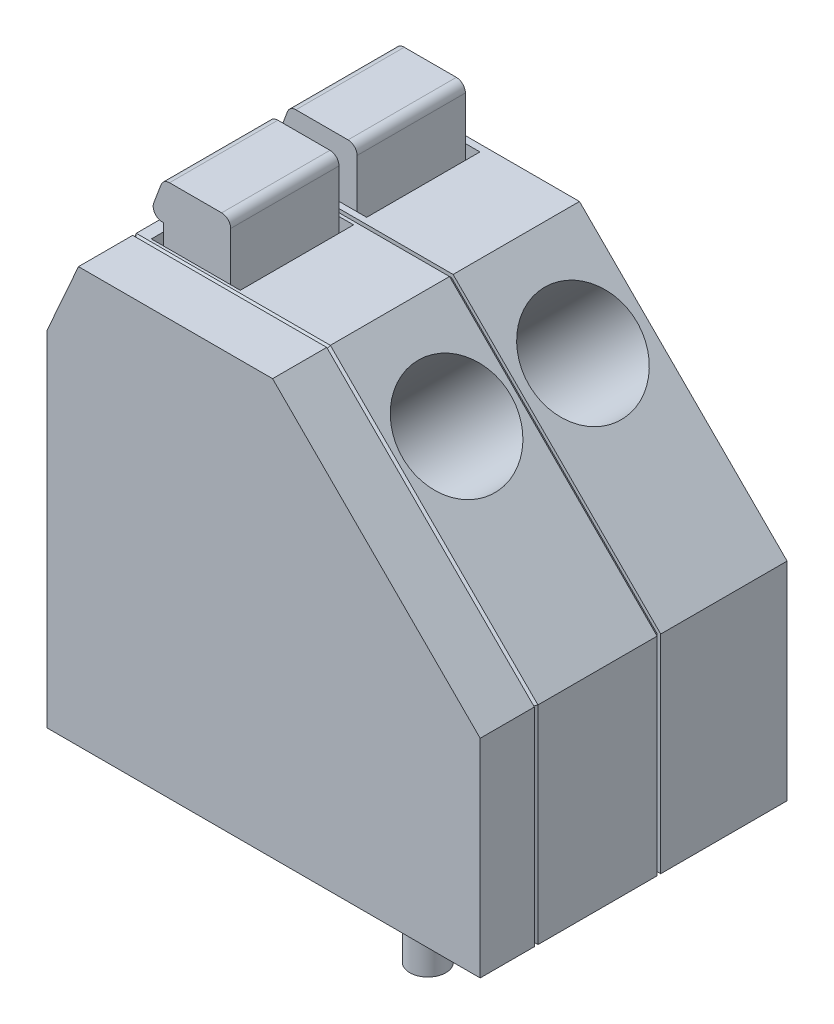
from build123d import *

# Parameters (mm, degrees)
BOSS_EXTRUDE1_DEPTH   = 3.5
SKETCH2_R             = 1.5
CUT_EXTRUDE1_DEPTH    = 5
SKETCH3_W             = 2.463564272
SKETCH3_H             = 3.137802915
CUT_EXTRUDE2_DEPTH    = 2
BOSS_EXTRUDE2_DEPTH   = 3
FILLET1_R             = 0.25
LPATTERN1_COUNT       = 2
LPATTERN1_PITCH       = 3.5
BOSS_EXTRUDE4_DEPTH   = 1.5
SKETCH8_R             = 0.5
BOSS_EXTRUDE5_DEPTH   = 3.6
BOSS_EXTRUDE5_2_DEPTH = 3.6
CHAMFER1_SIZE         = 0.1
SKETCH9_R             = 0.755713579
CUT_EXTRUDE3_DEPTH    = 0.2


with BuildPart() as part:
    # Sketch1 → Boss-Extrude1 (new body)
    with BuildSketch(Plane.XY):
        Polygon((0, 0), (12, 0), (12, 5.75), (6.25, 11.5), (0.875138122, 11.5), (0, 9.527071823), align=None)
    extrude(amount=BOSS_EXTRUDE1_DEPTH)

    # Sketch2 → Cut-Extrude1 (cut)
    with BuildSketch(Plane(origin=(8.875, 8.875, 0), x_dir=(0, 0, -1), z_dir=(0.7071067811865464, 0.7071067811865488, 0))):
        with Locations((-1.75, 1.10118655)):
            Circle(SKETCH2_R)
    extrude(amount=-CUT_EXTRUDE1_DEPTH, mode=Mode.SUBTRACT)

    # Sketch3 → Cut-Extrude2 (cut)
    with BuildSketch(Plane(origin=(0, 11.5, 0), x_dir=(1, 0, 0), z_dir=(0, 1, 0))):
        with Locations((2.451603039, -1.758644086)):
            Rectangle(SKETCH3_W, SKETCH3_H)
    extrude(amount=-CUT_EXTRUDE2_DEPTH, mode=Mode.SUBTRACT)


with BuildPart() as body_2:
    # Sketch5 → Boss-Extrude2 (new body)
    with BuildSketch(Plane(origin=(0, 0, 3.327545543), x_dir=(-1, 0, 0), z_dir=(0, 0, -1))):
        Polygon((-3.417684047, 9.5), (-3.417684047, 13.1), (-1.55035862, 13.1), (-1.160013757, 12.059784232), (-1.55035862, 12.059784232), (-1.55035862, 9.5), align=None)
    extrude(amount=BOSS_EXTRUDE2_DEPTH)

    # Fillet1
    fillet1_edges = [body_2.edges().sort_by_distance(p)[0] for p in [
        (1.160013757, 12.059784232, 1.827545543),
        (3.417684047, 13.1, 1.827545543),
        (1.55035862, 13.1, 1.827545543),
    ]]
    fillet(fillet1_edges, radius=FILLET1_R)


with BuildPart() as lpattern1_1:
    # LPattern1: pattern copy
    add(body_2.part.moved(Location(Vector(0, 0, 1) * (1 * LPATTERN1_PITCH))))


with BuildPart() as lpattern1_2:
    # LPattern1: pattern copy
    add(part.part.moved(Location(Vector(0, 0, 1) * (1 * LPATTERN1_PITCH))))

    # Chamfer1
    chamfer1_edges = [lpattern1_2.edges().sort_by_distance(p)[0] for p in [
        (6, 0, 7),
        (0, 4.763535912, 7),
        (0.437569061, 10.513535912, 7),
        (12, 2.875, 7),
        (3.562569061, 11.5, 7),
        (9.125, 8.625, 7),
        (6, 0, 3.5),
        (0, 4.763535912, 3.5),
        (0.437569061, 10.513535912, 3.5),
        (12, 2.875, 3.5),
        (3.562569061, 11.5, 3.5),
        (9.125, 8.625, 3.5),
    ]]
    chamfer(chamfer1_edges, length=CHAMFER1_SIZE)


with BuildPart() as body_5:
    # Sketch7 → Boss-Extrude4 (new body)
    with BuildSketch(Plane.XY.offset(7)):
        Polygon((0, 9.527071823), (0.875138122, 11.5), (6.25, 11.5), (12, 5.75), (12, 0), (0, 0), align=None)
    extrude(amount=BOSS_EXTRUDE4_DEPTH)


with BuildPart() as body_6:
    # Sketch8 → Boss-Extrude5 (new body)
    with BuildSketch(Plane.XZ):
        with Locations((7.3, 5.25)):
            Circle(SKETCH8_R)
    extrude(amount=BOSS_EXTRUDE5_DEPTH)


with BuildPart() as body_7:
    # Sketch8 → Boss-Extrude5 2 (new body)
    with BuildSketch(Plane.XZ):
        with Locations((2.3, 1.75)):
            Circle(SKETCH8_R)
    extrude(amount=BOSS_EXTRUDE5_2_DEPTH)


with BuildPart() as part_1:
    add(part.part)

    # Sketch9 → Cut-Extrude3 (cut)
    with BuildSketch(Plane(origin=(0, 0, 0), x_dir=(-1, 0, 0), z_dir=(0, 0, -1))):
        with Locations((-7.824779814, 2.638779832)):
            Circle(SKETCH9_R)
        with Locations((-2.362615501, 8.130785084)):
            Circle(SKETCH9_R)
    extrude(amount=-CUT_EXTRUDE3_DEPTH, mode=Mode.SUBTRACT)


solid = Compound([body_2.part, lpattern1_1.part, lpattern1_2.part, body_5.part, body_6.part, body_7.part, part_1.part])
